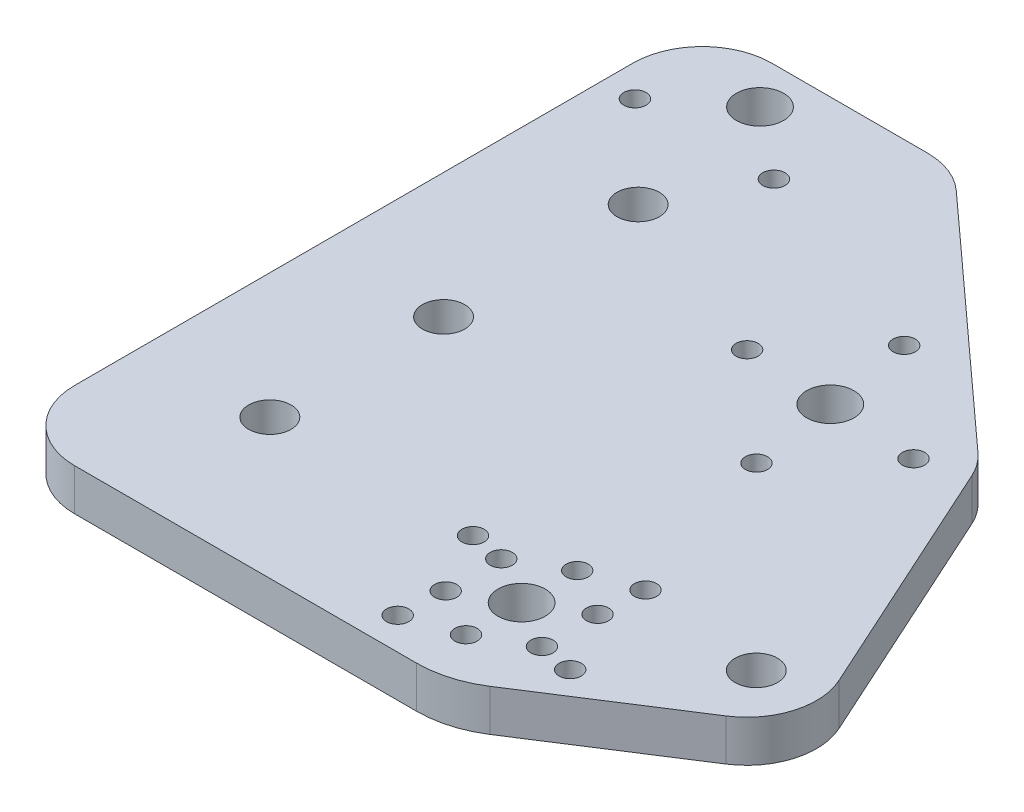
from build123d import *

# Parameters (mm, degrees)
ESBO_O1_R                = 3.4
ESBO_O1_R_2              = 1.6
ESBO_O1_R_3              = 3.05
RESSALTO_EXTRUS_O1_DEPTH = 6
ESBO_O2_R                = 3.05
CORTE_EXTRUS_O1_DEPTH    = 10
FILETE1_R                = 10


with BuildPart() as part:
    # Esboço1 → Ressalto-extrusão1 (new body)
    with BuildSketch(Plane.XZ.offset(6)):
        with BuildLine():
            ThreePointArc((148.858963728, -17.550205761), (150.213387743, -16.041631797), (151.235707119, -14.290882553))
            Line((151.235707119, -14.290882553), (167.194797105, 20.786465148))
            ThreePointArc((167.194797105, 20.786465148), (167.685761217, 27.75097204), (163.500492356, 33.339256802))
            Line((163.500492356, 33.339256802), (142.828800476, 46.629357452))
            ThreePointArc((142.828800476, 46.629357452), (138.919886426, 48.415130742), (134.666145804, 49.026919929))
            Line((134.666145804, 49.026919929), (75.43742995, 49.026919929))
            Line((75.43742995, 49.026919929), (75.43742995, -51.3))
            Line((75.43742995, -51.3), (107.856417314, -51.3))
            ThreePointArc((107.856417314, -51.3), (111.461591333, -50.627524875), (114.581887382, -48.700544058))
            Line((114.581887382, -48.700544058), (148.858963728, -17.550205761))
        make_face()
        with Locations((90.03742995, -45)):
            Circle(ESBO_O1_R, mode=Mode.SUBTRACT)
        with Locations((80.03742995, -37)):
            Circle(ESBO_O1_R_2, mode=Mode.SUBTRACT)
        with Locations((100.03742995, -37)):
            Circle(ESBO_O1_R_2, mode=Mode.SUBTRACT)
        with Locations((119.376459837, -13.805034822)):
            Circle(ESBO_O1_R_2, mode=Mode.SUBTRACT)
        with Locations((130.137211947, -25.645905315)):
            Circle(ESBO_O1_R_2, mode=Mode.SUBTRACT)
        with Locations((132.15737995, -13)):
            Circle(ESBO_O1_R, mode=Mode.SUBTRACT)
        with Locations((144.938300063, -12.194965178)):
            Circle(ESBO_O1_R_2, mode=Mode.SUBTRACT)
        with Locations((134.177547953, -0.354094685)):
            Circle(ESBO_O1_R_2, mode=Mode.SUBTRACT)
        with Locations((122.816922322, 29.075437545)):
            Circle(ESBO_O1_R_2, mode=Mode.SUBTRACT)
        with Locations((127.737942574, 29.932998956)):
            Circle(ESBO_O1_R_2, mode=Mode.SUBTRACT)
        with Locations((134.666145804, 25.932998956)):
            Circle(ESBO_O1_R_2, mode=Mode.SUBTRACT)
        with Locations((142.006279165, 23.439074893)):
            Circle(ESBO_O1_R_2, mode=Mode.SUBTRACT)
        with Locations((134.666145804, 33.932998956)):
            Circle(ESBO_O1_R, mode=Mode.SUBTRACT)
        with Locations((141.594349035, 29.932998956)):
            Circle(ESBO_O1_R_2, mode=Mode.SUBTRACT)
        with Locations((127.737942574, 37.932998956)):
            Circle(ESBO_O1_R_2, mode=Mode.SUBTRACT)
        with Locations((127.326012444, 44.426923019)):
            Circle(ESBO_O1_R_2, mode=Mode.SUBTRACT)
        with Locations((134.666145804, 41.932998956)):
            Circle(ESBO_O1_R_2, mode=Mode.SUBTRACT)
        with Locations((141.594349035, 37.932998956)):
            Circle(ESBO_O1_R_2, mode=Mode.SUBTRACT)
        with Locations((159.995303964, 25.487660186)):
            Circle(ESBO_O1_R_3, mode=Mode.SUBTRACT)
        with Locations((146.515369287, 38.790560368)):
            Circle(ESBO_O1_R_2, mode=Mode.SUBTRACT)
    extrude(amount=-RESSALTO_EXTRUS_O1_DEPTH)

    # Esboço2 → Corte-extrusão1 (cut)
    with BuildSketch(Plane.XZ.offset(6)):
        with Locations((93.43742995, 3.932998956)):
            Circle(ESBO_O2_R)
        with Locations((93.43742995, -24.067001044)):
            Circle(ESBO_O2_R)
        with Locations((93.43742995, 28.932998956)):
            Circle(ESBO_O2_R)
    extrude(amount=-CORTE_EXTRUS_O1_DEPTH, mode=Mode.SUBTRACT)

    # Filete1
    filete1_edges = [part.edges().sort_by_distance(p)[0] for p in [
        (75.43742995, -3, -51.3),
        (75.43742995, -3, 49.026919929),
    ]]
    fillet(filete1_edges, radius=FILETE1_R)


solid = part.part
